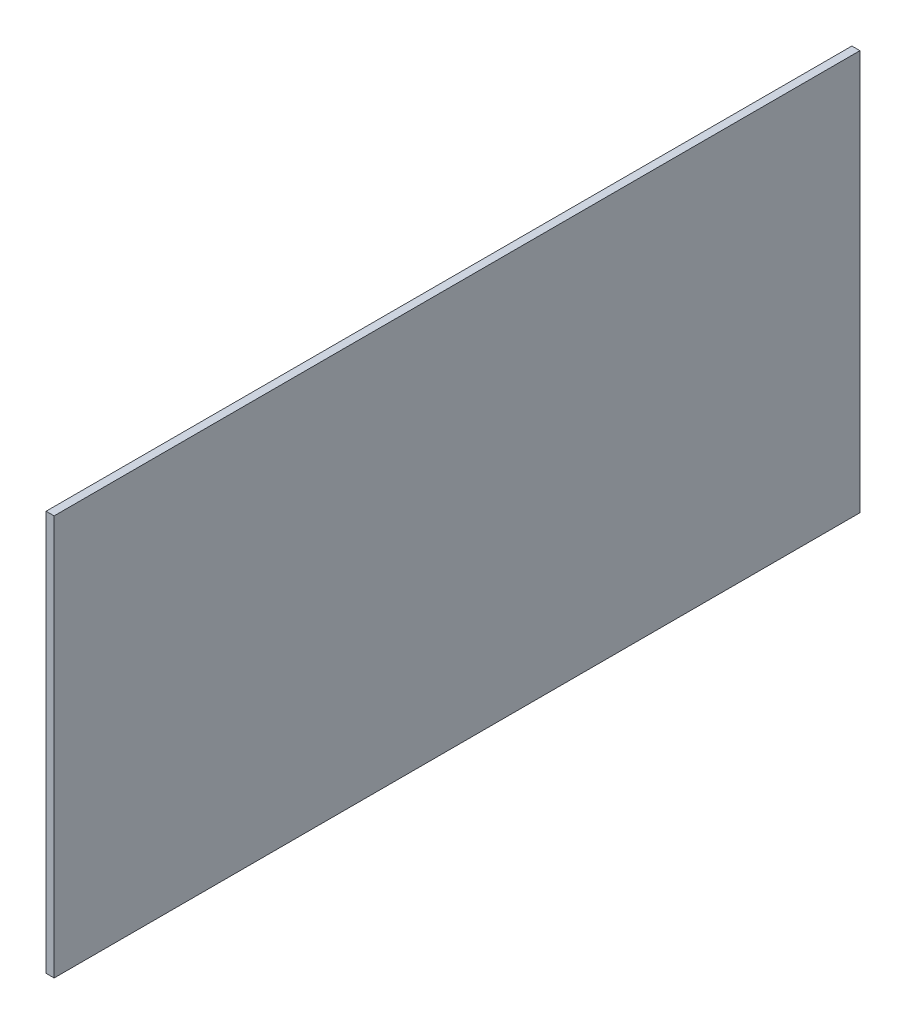
from build123d import *

# Parameters (mm, degrees)
SKETCH_1_W             = 300
SKETCH_1_H             = 149
SM_BASE_FLANGE_1_DEPTH = 3


# Sheet-metal steps are written as plain solids
with BuildPart() as part:
    # Sketch 1 → Базовая кромка1 (new body)
    with BuildSketch(Plane(origin=(0, 0, 0), x_dir=(0, 0, -1), z_dir=(1, 0, 0))):
        Rectangle(SKETCH_1_W, SKETCH_1_H)
    extrude(amount=-SM_BASE_FLANGE_1_DEPTH)


solid = part.part
